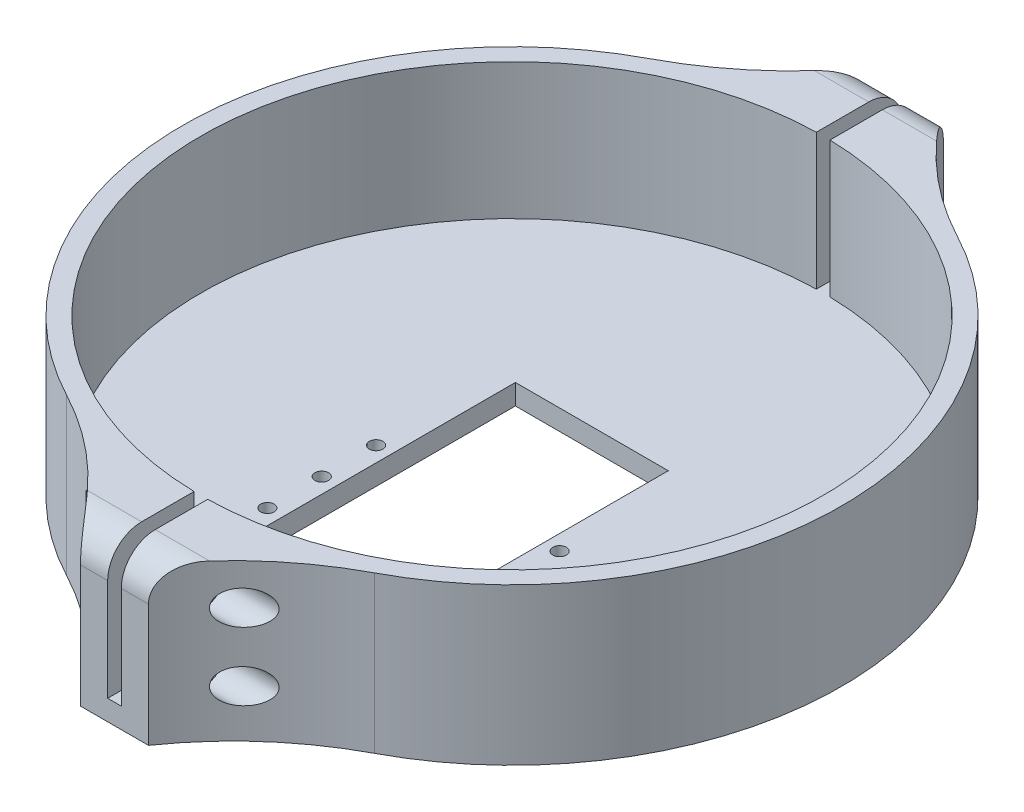
from build123d import *

# Parameters (mm, degrees)
SKETCH1_R               = 48.5
SKETCH1_R_2             = 45.8
BOSS_EXTRUDE1_DEPTH     = 20
BOSS_EXTRUDE2_START     = 3
SKETCH2_R               = 48.5
BOSS_EXTRUDE2_DEPTH     = 3
SKETCH5_W               = 117
SKETCH5_H               = 23
BOSS_EXTRUDE5_DEPTH     = 5
CUT_EXTRUDE2_START      = -20
CUT_EXTRUDE2_DEPTH      = 20
FILLET1_R               = 50
SKETCH3_W               = 22.5
SKETCH3_H               = 44.5
CUT_EXTRUDE1_DEPTH      = 3
FILLET2_R               = 5
SKETCH7_R               = 1.5
CUT_EXTRUDE3_DEPTH      = 40.5
SKETCH8_R               = 2.5
CUT_EXTRUDE4_DEPTH      = 10
MIRROR2_COPY_1_SKETCH_R = 2.5
MIRROR2_COPY_1_DEPTH    = 10
SKETCH9_R               = 1
CUT_EXTRUDE5_DEPTH      = 3


with BuildPart() as part:
    # Sketch1 → Boss-Extrude1 (new body)
    with BuildSketch(Plane(origin=(0, 0, 0), x_dir=(1, 0, 0), z_dir=(0, 1, 0))):
        with Locations(Location((0, 0, 0), (0, 0, 270))):
            Circle(SKETCH1_R)
        with Locations(Location((0, 0, 0), (0, 0, 270))):
            Circle(SKETCH1_R_2, mode=Mode.SUBTRACT)
    extrude(amount=BOSS_EXTRUDE1_DEPTH)

    # Sketch2 → Boss-Extrude2 (add)
    with BuildSketch(Plane.XZ.offset(BOSS_EXTRUDE2_START)):
        with Locations(Location((0, 0, 0), (0, 0, 270))):
            Circle(SKETCH2_R)
    extrude(amount=-BOSS_EXTRUDE2_DEPTH)

    # Sketch5 → Boss-Extrude5 (add, symmetric)
    with BuildSketch(Plane(origin=(0, 0, 0), x_dir=(0, 0, -1), z_dir=(1, 0, 0))):
        with Locations((0, 8.5)):
            Rectangle(SKETCH5_W, SKETCH5_H)
    extrude(amount=BOSS_EXTRUDE5_DEPTH, both=True)

    # Sketch6 → Cut-Extrude2 (cut)
    with BuildSketch(Plane(origin=(0, 20, 0), x_dir=(1, 0, 0), z_dir=(0, 1, 0)).offset(CUT_EXTRUDE2_START)):
        with BuildLine():
            Line((-1, 58.5), (1, 58.5))
            Line((1, 58.5), (1, 45.789081668))
            ThreePointArc((1, 45.789081668), (45.8, 0), (1, -45.789081668))
            Line((1, -45.789081668), (1, -58.5))
            Line((1, -58.5), (-1, -58.5))
            Line((-1, -58.5), (-1, -45.789081668))
            ThreePointArc((-1, -45.789081668), (-45.8, 0), (-1, 45.789081668))
            Line((-1, 45.789081668), (-1, 58.5))
        make_face()
    extrude(amount=CUT_EXTRUDE2_DEPTH, mode=Mode.SUBTRACT)

    # Fillet1
    # the kernel refuses this fillet: 50 mm, written as the material it adds along each edge
    with BuildSketch(Plane(origin=(5, -3, 48.241579576), x_dir=(0, 0, 1), z_dir=(0, 1, 0)), Plane(origin=(-5, 20, 48.241579576), x_dir=(0, 0, 1), z_dir=(0, -1, 0))) as fillet1_piece_1:
        with BuildLine():
            CenterArc((38.846361668, 41.021087448), FILLET1_R, 207.853937199, 27.273097551)
            Line((-5.360715106, 17.660129353), (-6.244856641, 17.192910191))
            ThreePointArc((-6.244856641, 17.192910191), (-2.789469198, 8.796943943), (-0.994671744, -0.103092784))
            Line((-0.994671744, -0.103092784), (0, -1))
            ThreePointArc((0, -1), (5.129210212, -1), (9.686661599, -0.820421749))
            Line((9.686661599, -0.820421749), (10.258420424, 0))
        make_face()
    extrude(amount=23)
    with BuildSketch(Plane(origin=(5, -3, -48.241579576), x_dir=(0, 0, -1), z_dir=(0, 1, 0))) as fillet1_piece_2:
        with BuildLine():
            CenterArc((38.846361668, -41.021087448), FILLET1_R, 124.87296525, 27.273097551)
            Line((-5.360715106, -17.660129353), (-6.244856641, -17.192910191))
            ThreePointArc((-6.244856641, -17.192910191), (-2.789469198, -8.796943943), (-0.994671744, 0.103092784))
            Line((-0.994671744, 0.103092784), (0, 1))
            ThreePointArc((0, 1), (5.129210212, 1), (9.686661599, 0.820421749))
            Line((9.686661599, 0.820421749), (10.258420424, 0))
        make_face()
    extrude(amount=23)
    with BuildSketch(Plane(origin=(-5, 20, -48.241579576), x_dir=(-0.9568865342808892, 1.0362221304111928e-14, 0.290461977738754), z_dir=(0, -1, 0))) as fillet1_piece_3:
        with BuildLine():
            CenterArc((27.969135163, 49.086626575), FILLET1_R, 231.758581225, 27.273097551)
            Line((-2.979681085, 9.816144367), (-3.59865741, 9.030734722))
            ThreePointArc((-3.59865741, 9.030734722), (-2.446727077, 4.617610206), (-0.956886534, -0.290461978))
            Line((-0.956886534, -0.290461978), (0.190266226, -0.981732531))
            ThreePointArc((0.190266226, -0.981732531), (9.227911942, -0.114027778), (18.265557657, -0.981732531))
            Line((18.265557657, -0.981732531), (18.455823883, 0))
        make_face()
    extrude(amount=23)

    # Sketch3 → Cut-Extrude1 (cut)
    with BuildSketch(Plane(origin=(0, 0, 0), x_dir=(1, 0, 0), z_dir=(0, 1, 0))):
        with Locations((0, -10.5)):
            Rectangle(SKETCH3_W, SKETCH3_H)
    extrude(amount=-CUT_EXTRUDE1_DEPTH, mode=Mode.SUBTRACT)

    # Fillet2
    fillet2_edges = [part.edges().sort_by_distance(p)[0] for p in [
        (3, 20, 58.5),
        (3, 20, -58.5),
        (-3, 20, 58.5),
        (-3, 20, -58.5),
    ]]
    fillet(fillet2_edges, radius=FILLET2_R)

    # Sketch7 → Cut-Extrude3 (cut, symmetric)
    with BuildSketch(Plane(origin=(0, 0, 0), x_dir=(0, 0, -1), z_dir=(1, 0, 0))):
        with Locations((51, 14)):
            Circle(SKETCH7_R)
        with Locations((51, 4)):
            Circle(SKETCH7_R)
        with Locations((-51, 14)):
            Circle(SKETCH7_R)
        with Locations((-51, 4)):
            Circle(SKETCH7_R)
    extrude(amount=CUT_EXTRUDE3_DEPTH, both=True, mode=Mode.SUBTRACT)

    # Sketch8 → Cut-Extrude4 (cut)
    with BuildSketch(Plane(origin=(-16, 0, 0), x_dir=(0, 0, -1), z_dir=(1, 0, 0))):
        with Locations(Location((51, 14, 0), (0, 0, 180))):
            Circle(SKETCH8_R)
        with Locations(Location((51, 4, 0), (0, 0, 180))):
            Circle(SKETCH8_R)
    cut_extrude4 = extrude(amount=CUT_EXTRUDE4_DEPTH, mode=Mode.SUBTRACT)

    # Mirror1: Cut-Extrude4 across plane
    add(cut_extrude4.mirror(Plane(origin=(0, 0, 0), x_dir=(0, 0, 1), z_dir=(1, 0, 0))), mode=Mode.SUBTRACT)

    # Mirror2: Cut-Extrude4 across plane
    add(cut_extrude4.mirror(Plane.XY), mode=Mode.SUBTRACT)

    # Mirror2 copy 1 sketch → Mirror2 copy 1 (cut)
    with BuildSketch(Plane.ZY.offset(-16)):
        with Locations(Location((51, 14, 0), (0, 0, 180))):
            Circle(MIRROR2_COPY_1_SKETCH_R)
        with Locations(Location((51, 4, 0), (0, 0, 180))):
            Circle(MIRROR2_COPY_1_SKETCH_R)
    extrude(amount=MIRROR2_COPY_1_DEPTH, mode=Mode.SUBTRACT)

    # Sketch9 → Cut-Extrude5 (cut)
    with BuildSketch(Plane(origin=(0, 0, 0), x_dir=(1, 0, 0), z_dir=(0, 1, 0))):
        with Locations(Location((13.5, -6.5, 0), (0, 0, 270))):
            Circle(SKETCH9_R)
        with Locations(Location((13.5, -14.5, 0), (0, 0, 270))):
            Circle(SKETCH9_R)
        with Locations(Location((13.5, -22.5, 0), (0, 0, 270))):
            Circle(SKETCH9_R)
        with Locations(Location((13.5, -30.5, 0), (0, 0, 270))):
            Circle(SKETCH9_R)
        with Locations(Location((8, -36, 0), (0, 0, 270))):
            Circle(SKETCH9_R)
        with Locations(Location((-8, -36, 0), (0, 0, 90))):
            Circle(SKETCH9_R)
        with Locations(Location((-13.5, -30.5, 0), (0, 0, 90))):
            Circle(SKETCH9_R)
        with Locations(Location((-13.5, -22.5, 0), (0, 0, 90))):
            Circle(SKETCH9_R)
        with Locations(Location((-13.5, -14.5, 0), (0, 0, 90))):
            Circle(SKETCH9_R)
        with Locations(Location((-13.5, -6.5, 0), (0, 0, 90))):
            Circle(SKETCH9_R)
    extrude(amount=-CUT_EXTRUDE5_DEPTH, mode=Mode.SUBTRACT)


solid = part.part
